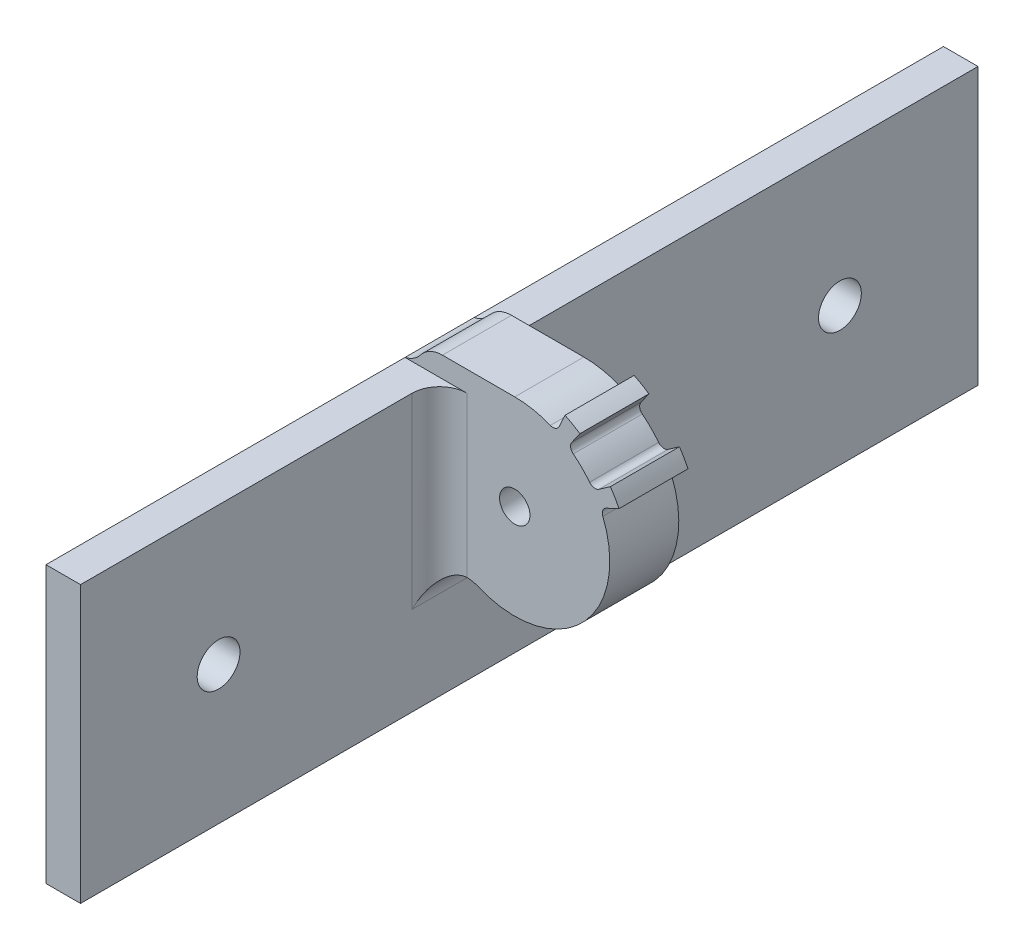
from build123d import *

# Parameters (mm, degrees)
SKETCH2_R                = 1.1
BOSS_EXTRUDE1_DEPTH      = 5
BOSS_EXTRUDE2_DEPTH      = 1.5
BOSS_EXTRUDE2_DEPTH_BACK = 1
SKETCH4_W                = 65
SKETCH4_H                = 20
SKETCH4_R                = 1.55
FILLET1_R                = 2
FILLET2_R                = 2
FILLET3_DEPTH            = 5
FILLET3_START            = -46.68249578
FILLET3_2_DEPTH          = 13.56249578
FILLET3_START_2          = 5
FILLET3_3_DEPTH          = 3
FILLET4_START            = -44.68249568
FILLET4_DEPTH            = 11.56249568
FILLET4_START_2          = -46.68249588
FILLET4_2_DEPTH          = 2.0000002
FILLET4_START_3          = -2
FILLET4_3_DEPTH          = 2
BOSS_EXTRUDE3_START      = -5
BOSS_EXTRUDE3_DEPTH      = 5


with BuildPart() as part:
    # Sketch2 → Boss-Extrude1 (new body)
    with BuildSketch(Plane.XY):
        with BuildLine():
            Line((20.317595566, -31.62), (26.767401765, -31.62))
            ThreePointArc((26.767401765, -31.62), (28.079366857, -31.746249368), (29.343182309, -32.120364071))
            ThreePointArc((29.343182309, -32.120364071), (29.713933476, -32.121815396), (29.983758291, -31.867545651))
            Line((29.983758291, -31.867545651), (30.409159516, -30.952682564))
            ThreePointArc((30.409159516, -30.952682564), (30.957401765, -31.242707116), (31.482691519, -31.572486555))
            Line((31.482691519, -31.572486555), (30.903097457, -32.398326366))
            ThreePointArc((30.903097457, -32.398326366), (30.817805806, -32.759136383), (31.004438274, -33.07949065))
            ThreePointArc((31.004438274, -33.07949065), (33.576739296, -37.51647451), (32.365115584, -42.5))
            ThreePointArc((32.365115584, -42.5), (27.155948468, -45.369019687), (21.656472124, -43.105735361))
            Line((21.656472124, -43.105735361), (20.317595566, -41.62))
            Line((20.317595566, -41.62), (20.317595566, -31.62))
        make_face()
        with Locations(Location((26.767401765, -38.5, 0), (0, 0, 180))):
            Circle(SKETCH2_R, mode=Mode.SUBTRACT)
    extrude(amount=BOSS_EXTRUDE1_DEPTH)

    # Sketch4 → Boss-Extrude2 (add, two sides: drawn at the far end of the back side and taken through both)
    with BuildSketch(Plane.ZY.offset(-20.317595566).offset(-BOSS_EXTRUDE2_DEPTH_BACK)):
        with Locations((-1.5, -43.12)):
            Rectangle(SKETCH4_W, SKETCH4_H)
        with Locations((21, -43.12)):
            Circle(SKETCH4_R, mode=Mode.SUBTRACT)
        with Locations((-24, -43.12)):
            Circle(SKETCH4_R, mode=Mode.SUBTRACT)
    extrude(amount=BOSS_EXTRUDE2_DEPTH + BOSS_EXTRUDE2_DEPTH_BACK)

    # Fillet1
    # the kernel refuses this fillet: 2 mm, written as the material it adds along each edge
    with BuildSketch(Plane(origin=(20.317595566, -33.12, 5), x_dir=(0, 1, 0), z_dir=(0, 0, -1))) as fillet1_piece_1:
        with BuildLine():
            CenterArc((1.948957881, -1.948957881), FILLET1_R, 102.972239886, 64.055520228)
            Line((0, -1.5), (0, 0))
            Line((0, 0), (1.5, 0))
        make_face()
    extrude(amount=5)

    # Fillet2
    fillet2_edges = [part.edges().sort_by_distance(p)[0] for p in [
        (20.317595566, -31.62, 2.5),
    ]]
    fillet(fillet2_edges, radius=FILLET2_R)

    # Fillet3: read off the stored shape, not the designer's step
    # Fillet3 outline → Fillet3 (add)
    with BuildSketch(Plane.XY):
        with BuildLine():
            Line((21.317595566, -42.729688082), (21.317595566, -46.68249578))
            ThreePointArc((21.317595566, -46.68249578), (22.211694747, -45.01606745), (24.094578944, -44.839591325))
            ThreePointArc((24.094578944, -44.839591325), (22.780138954, -44.106793672), (21.656472124, -43.105735361))
            Line((21.656472124, -43.105735361), (21.317595566, -42.729688082))
        make_face()
    extrude(amount=FILLET3_DEPTH)

    # Fillet3 2 outline → Fillet3 2 (add)
    with BuildSketch(Plane(origin=(0, 0, 0), x_dir=(1, 0, 0), z_dir=(0, 1, 0)).offset(FILLET3_START)):
        with BuildLine():
            Line((21.317595566, -5), (21.317595566, -7))
            ThreePointArc((21.317595566, -7), (21.903382004, -5.585786438), (23.317595566, -5))
            Line((23.317595566, -5), (21.317595566, -5))
        make_face()
    extrude(amount=FILLET3_2_DEPTH)

    # Fillet3 3 outline → Fillet3 3 (cut)
    with BuildSketch(Plane.XY.offset(FILLET3_START_2)):
        with BuildLine():
            ThreePointArc((24.094578944, -44.839591325), (22.211694747, -45.01606745), (21.317595566, -46.68249578))
            Line((21.317595566, -46.68249578), (25, -46.68249578))
            Line((25, -46.68249578), (25, -45.221324143))
            Line((25, -45.221324143), (24.094578944, -44.839591325))
        make_face()
    extrude(amount=FILLET3_3_DEPTH, mode=Mode.SUBTRACT)

    # Fillet4: read off the stored shape, not the designer's step
    # Fillet4 outline → Fillet4 (add)
    with BuildSketch(Plane(origin=(0, 0, 0), x_dir=(1, 0, 0), z_dir=(0, 1, 0)).offset(FILLET4_START)):
        with BuildLine():
            ThreePointArc((22.317595566, 0), (21.610488785, 0.292893219), (21.317595566, 1))
            Line((21.317595566, 1), (21.317595566, 0))
            Line((21.317595566, 0), (22.317595566, 0))
        make_face()
    extrude(amount=FILLET4_DEPTH)

    # Fillet4 2 outline → Fillet4 2 (add)
    with BuildSketch(Plane(origin=(0, 0, 0), x_dir=(1, 0, 0), z_dir=(0, 1, 0)).offset(FILLET4_START_2)):
        with BuildLine():
            ThreePointArc((22.317595566, 0), (21.610488785, 0.292893219), (21.317595566, 1))
            Line((21.317595566, 1), (21.317595566, 0))
            Line((21.317595566, 0), (22.317595566, 0))
        make_face()
    extrude(amount=FILLET4_2_DEPTH)

    # Fillet4 3 outline → Fillet4 3 (cut)
    with BuildSketch(Plane.XY.offset(FILLET4_START_3)):
        with BuildLine():
            ThreePointArc((24, -44.802515943), (22.169729909, -45.044691019), (21.317595566, -46.68249578))
            Line((21.317595566, -46.68249578), (24, -46.68249588))
            Line((24, -46.68249588), (24, -44.802515943))
        make_face()
    extrude(amount=FILLET4_3_DEPTH, mode=Mode.SUBTRACT)

    # Sketch5 → Boss-Extrude3 (add)
    with BuildSketch(Plane(origin=(0, 0, 5), x_dir=(-1, 0, 0), z_dir=(0, 0, 1)).offset(BOSS_EXTRUDE3_START)):
        with BuildLine():
            Line((-33.69491521, 33.784710246), (-32.869075399, 34.364304307))
            ThreePointArc((-32.869075399, 34.364304307), (-32.508265382, 34.449595959), (-32.187911115, 34.262963491))
            Line((-32.187911115, 34.262963491), (-31.321885711, 34.762963491))
            Line((-31.321885711, 34.762963491), (-32.28101229, 36.424219456))
            Line((-32.28101229, 36.424219456), (-33.147037694, 35.924219456))
            ThreePointArc((-33.147037694, 35.924219456), (-33.145586368, 35.553468289), (-33.399856114, 35.283643474))
            Line((-33.399856114, 35.283643474), (-34.314719201, 34.858242249))
            ThreePointArc((-34.314719201, 34.858242249), (-34.024694648, 34.31), (-33.69491521, 33.784710246))
        make_face()
    extrude(amount=BOSS_EXTRUDE3_DEPTH)


solid = part.part
